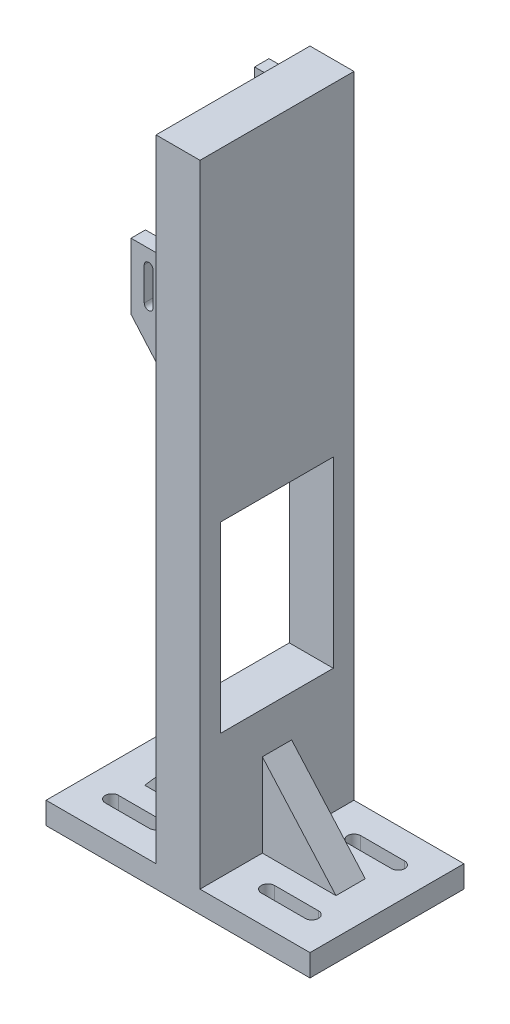
from build123d import *

# Parameters (mm, degrees)
SKETCH1_W               = 120
SKETCH1_H               = 70
BOSS_EXTRUDE1_DEPTH     = 10
SKETCH1_3_W             = 20
SKETCH1_3_H             = 70
BOSS_EXTRUDE2_DEPTH     = 162
BOSS_EXTRUDE3_START     = -20
SKETCH2_W               = 6.560281302
SKETCH2_H               = 30
BOSS_EXTRUDE3_DEPTH     = 15
BOSS_EXTRUDE3_2_DEPTH   = 15
BOSS_EXTRUDE3_3_DEPTH   = 15
CUT_EXTRUDE3_DEPTH      = 101.2
CUT_EXTRUDE3_DEPTH_BACK = 127.2
SKETCH7_W               = 20
SKETCH7_H               = 70
BOSS_EXTRUDE4_DEPTH     = 135
SKETCH12_W              = 15
SKETCH12_H              = 6.560281302
BOSS_EXTRUDE6_DEPTH     = 26.31701322
BOSS_EXTRUDE7_START     = -31.360281302
BOSS_EXTRUDE7_DEPTH     = 6.560281302
BOSS_EXTRUDE8_START     = -31.360281302
BOSS_EXTRUDE8_DEPTH     = 6.560281302
SKETCH3_W               = 51.18180782
SKETCH3_H               = 83.211673014
CUT_EXTRUDE1_DEPTH      = 60
BOSS_EXTRUDE9_START     = -6.650550524
BOSS_EXTRUDE9_DEPTH     = 13.301101048


# Read off the part's stored shape, not the designer's step: Boss-Extrude7, Boss-Extrude8, Boss-Extrude9
with BuildPart() as part:
    # Sketch1 → Boss-Extrude1 (new body)
    with BuildSketch(Plane(origin=(0, 0, 0), x_dir=(1, 0, 0), z_dir=(0, 1, 0))):
        Rectangle(SKETCH1_W, SKETCH1_H)
        with BuildLine():
            Line((-45.469645663, 22.603573917), (-25.469645663, 22.603573917))
            ThreePointArc((-25.469645663, 22.603573917), (-22.469645663, 19.603573917), (-25.469645663, 16.603573917))
            Line((-25.469645663, 16.603573917), (-45.469645663, 16.603573917))
            ThreePointArc((-45.469645663, 16.603573917), (-48.469645663, 19.603573917), (-45.469645663, 22.603573917))
        make_face(mode=Mode.SUBTRACT)
        with BuildLine():
            Line((45.469645663, 22.603573917), (25.469645663, 22.603573917))
            ThreePointArc((25.469645663, 22.603573917), (22.469645663, 19.603573917), (25.469645663, 16.603573917))
            Line((25.469645663, 16.603573917), (45.469645663, 16.603573917))
            ThreePointArc((45.469645663, 16.603573917), (48.469645663, 19.603573917), (45.469645663, 22.603573917))
        make_face(mode=Mode.SUBTRACT)
        with BuildLine():
            Line((45.469645663, -22.603573917), (25.469645663, -22.603573917))
            ThreePointArc((25.469645663, -22.603573917), (22.469645663, -19.603573917), (25.469645663, -16.603573917))
            Line((25.469645663, -16.603573917), (45.469645663, -16.603573917))
            ThreePointArc((45.469645663, -16.603573917), (48.469645663, -19.603573917), (45.469645663, -22.603573917))
        make_face(mode=Mode.SUBTRACT)
        with BuildLine():
            Line((-45.469645663, -22.603573917), (-25.469645663, -22.603573917))
            ThreePointArc((-25.469645663, -22.603573917), (-22.469645663, -19.603573917), (-25.469645663, -16.603573917))
            Line((-25.469645663, -16.603573917), (-45.469645663, -16.603573917))
            ThreePointArc((-45.469645663, -16.603573917), (-48.469645663, -19.603573917), (-45.469645663, -22.603573917))
        make_face(mode=Mode.SUBTRACT)
    extrude(amount=BOSS_EXTRUDE1_DEPTH)

    # Sketch1<3> → Boss-Extrude2 (add)
    with BuildSketch(Plane(origin=(0, 0, 0), x_dir=(1, 0, 0), z_dir=(0, 1, 0))):
        Rectangle(SKETCH1_3_W, SKETCH1_3_H)
    extrude(amount=BOSS_EXTRUDE2_DEPTH)


with BuildPart() as body_2:
    # Sketch2 → Boss-Extrude3 (new body)
    with BuildSketch(Plane(origin=(10, 0, 0), x_dir=(0, 0, -1), z_dir=(1, 0, 0)).offset(BOSS_EXTRUDE3_START)):
        with Locations((-28.080140651, 231.998095635)):
            Rectangle(SKETCH2_W, SKETCH2_H)
    extrude(amount=-BOSS_EXTRUDE3_DEPTH)


with BuildPart() as body_3:
    # Sketch2 → Boss-Extrude3 2 (new body)
    with BuildSketch(Plane(origin=(10, 0, 0), x_dir=(0, 0, -1), z_dir=(1, 0, 0)).offset(BOSS_EXTRUDE3_START)):
        with Locations((28.080140651, 182.13639327)):
            Rectangle(SKETCH2_W, SKETCH2_H)
    extrude(amount=-BOSS_EXTRUDE3_2_DEPTH)


with BuildPart() as body_4:
    # Sketch2 → Boss-Extrude3 3 (new body)
    with BuildSketch(Plane(origin=(10, 0, 0), x_dir=(0, 0, -1), z_dir=(1, 0, 0)).offset(BOSS_EXTRUDE3_START)):
        with Locations((28.080140651, 271.354236176)):
            Rectangle(SKETCH2_W, SKETCH2_H)
    extrude(amount=-BOSS_EXTRUDE3_3_DEPTH)


with BuildPart() as cut_extrude3_tool:
    # Sketch5 → Cut-Extrude3 (new, two sides: drawn at the far end of the back side and taken through both)
    with BuildSketch(Plane.XY.offset(-24.8).offset(-CUT_EXTRUDE3_DEPTH_BACK)):
        with BuildLine():
            Line((-15, 239.498095635), (-15, 224.498095635))
            ThreePointArc((-15, 224.498095635), (-17, 222.498095635), (-19, 224.498095635))
            Line((-19, 224.498095635), (-19, 239.498095635))
            ThreePointArc((-19, 239.498095635), (-17, 241.498095635), (-15, 239.498095635))
        make_face()
        with BuildLine():
            Line((-15, 189.63639327), (-15, 174.63639327))
            ThreePointArc((-15, 174.63639327), (-17, 172.63639327), (-19, 174.63639327))
            Line((-19, 174.63639327), (-19, 189.63639327))
            ThreePointArc((-19, 189.63639327), (-17, 191.63639327), (-15, 189.63639327))
        make_face()
        with BuildLine():
            Line((-15, 278.854236176), (-15, 263.854236176))
            ThreePointArc((-15, 263.854236176), (-17, 261.854236176), (-19, 263.854236176))
            Line((-19, 263.854236176), (-19, 278.854236176))
            ThreePointArc((-19, 278.854236176), (-17, 280.854236176), (-15, 278.854236176))
        make_face()
    extrude(amount=CUT_EXTRUDE3_DEPTH + CUT_EXTRUDE3_DEPTH_BACK)


with BuildPart() as body_2_1:
    add(body_2.part)

    # Cut-Extrude3: cut by cut_extrude3_tool
    add(cut_extrude3_tool.part, mode=Mode.SUBTRACT)



with BuildPart() as body_3_1:
    add(body_3.part)

    # Cut-Extrude3: cut by cut_extrude3_tool
    add(cut_extrude3_tool.part, mode=Mode.SUBTRACT)


with BuildPart() as body_4_1:
    add(body_4.part)

    # Cut-Extrude3: cut by cut_extrude3_tool
    add(cut_extrude3_tool.part, mode=Mode.SUBTRACT)


with BuildPart() as body_2_2:
    add(body_2_1.part)

    add(body_4_1.part)  # Boss-Extrude4 merges body 4

    add(part.part)  # Boss-Extrude4 merges part
    # Sketch7 → Boss-Extrude4 (add)
    with BuildSketch(Plane(origin=(0, 162, 0), x_dir=(1, 0, 0), z_dir=(0, 1, 0))):
        Rectangle(SKETCH7_W, SKETCH7_H)
    extrude(amount=BOSS_EXTRUDE4_DEPTH)

    # Sketch12 → Boss-Extrude6 (add, along a direction that is not the sketch's normal)
    with BuildSketch(Plane.XZ.offset(-216.998095635)):
        with Locations((-17.5, 28.080140651)):
            Rectangle(SKETCH12_W, SKETCH12_H)
    extrude(amount=BOSS_EXTRUDE6_DEPTH, dir=(0.6560590289905114, -0.7547095802227685, 0))

    # Boss-Extrude7 outline → Boss-Extrude7 (add)
    with BuildSketch(Plane.XY.offset(BOSS_EXTRUDE7_START)):
        Polygon((-25, 256.354236176), (-10, 239.098710067), (-10, 256.354236176), align=None)
    extrude(amount=BOSS_EXTRUDE7_DEPTH)

    # Boss-Extrude8 outline → Boss-Extrude8 (add)
    with BuildSketch(Plane.XY.offset(BOSS_EXTRUDE8_START)):
        Polygon((-10, 167.13639327), (-25, 167.13639327), (-10, 149.880867162), align=None)
    extrude(amount=BOSS_EXTRUDE8_DEPTH)

    # Sketch3 → Cut-Extrude1 (cut)
    with BuildSketch(Plane(origin=(10, 0, 0), x_dir=(0, 0, -1), z_dir=(1, 0, 0))):
        with Locations((0, 108.275030655)):
            Rectangle(SKETCH3_W, SKETCH3_H)
    extrude(amount=-CUT_EXTRUDE1_DEPTH, mode=Mode.SUBTRACT)

    # Boss-Extrude9 outline → Boss-Extrude9 (add)
    with BuildSketch(Plane.XY.offset(BOSS_EXTRUDE9_START)):
        Polygon((43.472980585, 10), (10, 47.93773671), (10, 10), align=None)
    boss_extrude9 = extrude(amount=BOSS_EXTRUDE9_DEPTH)

    # Mirror1: Boss-Extrude9 across plane
    add(boss_extrude9.mirror(Plane(origin=(0, 0, 0), x_dir=(0, 0, 1), z_dir=(1, 0, 0))))


solid = Compound([body_3_1.part, body_2_2.part])
